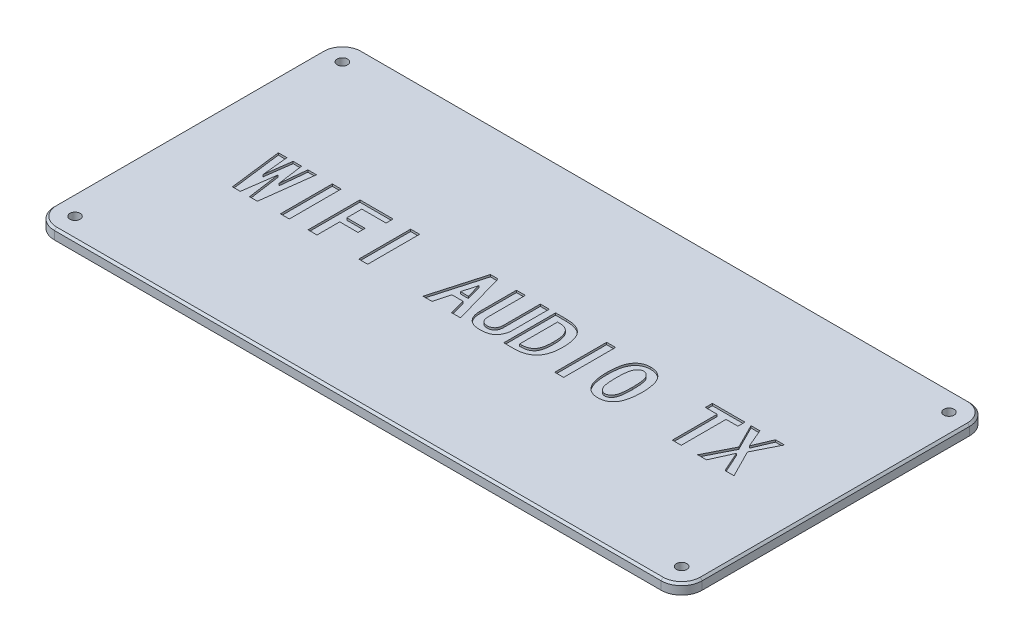
from build123d import *

# Parameters (mm, degrees)
EXTRUDE_1_DEPTH           = 2
SKETCH_2_R                = 1
CUT_EXTRUDE_1_DEPTH       = 2
CUT_EXTRUDE_START         = -0.4
CUT_EXTRUDE_2_OUTLINE_W   = 1.734892788
CUT_EXTRUDE_2_OUTLINE_H   = 10.090968161
CUT_EXTRUDE_2_OUTLINE_W_2 = 1.734892787
CUT_EXTRUDE_2_DEPTH       = 0.4
CHAMFER_1_SIZE            = 0.4


# Read off the part's stored shape, not the designer's step: 切除-拉伸2
with BuildPart() as part:
    # 草图1 → 凸台-拉伸1 (new body)
    with BuildSketch(Plane(origin=(0, 0, 0), x_dir=(1, 0, 0), z_dir=(0, 1, 0))):
        with BuildLine():
            Line((4, 0), (122, 0))
            ThreePointArc((122, 0), (124.828427125, 1.171572875), (126, 4))
            Line((126, 4), (126, 56))
            ThreePointArc((126, 56), (124.828427125, 58.828427125), (122, 60))
            Line((122, 60), (4, 60))
            ThreePointArc((4, 60), (1.171572875, 58.828427125), (0, 56))
            Line((0, 56), (0, 4))
            ThreePointArc((0, 4), (1.171572875, 1.171572875), (4, 0))
        make_face()
    extrude(amount=EXTRUDE_1_DEPTH)

    # 草图2 → 切除-拉伸1 (cut)
    with BuildSketch(Plane(origin=(0, 0, 0), x_dir=(-1, 0, 0), z_dir=(0, -1, 0))):
        with Locations(Location((-122, 4, 0), (0, 0, 90))):
            Circle(SKETCH_2_R)
        with Locations(Location((-122, 56, 0), (0, 0, 90))):
            Circle(SKETCH_2_R)
        with Locations(Location((-4, 56, 0), (0, 0, 90))):
            Circle(SKETCH_2_R)
        with Locations(Location((-4, 4, 0), (0, 0, 90))):
            Circle(SKETCH_2_R)
    extrude(amount=-CUT_EXTRUDE_1_DEPTH, mode=Mode.SUBTRACT)

    # 切除-拉伸2 outline → 切除-拉伸2 (cut)
    # profile 1 of 11: a face of its own
    with BuildSketch(Plane(origin=(0, 2, 0), x_dir=(1, 0, 0), z_dir=(0, 1, 0)).offset(CUT_EXTRUDE_START)):
        with BuildLine():
            add(Edge.make_bspline(
                [(85.38227287, 34.590226226), (85.517467863, 34.586454589), (85.781137425, 34.5790988), (86.164303937, 34.522748921), (86.522256181, 34.426690854), (86.857639647, 34.295233804), (87.165552006, 34.119970878), (87.450967055, 33.910293541), (87.710099989, 33.6612892), (87.943456693, 33.372391473), (88.150415551, 33.041561015), (88.330472898, 32.666100825), (88.4807517, 32.243973045), (88.602927804, 31.775538604), (88.699756944, 31.261738674), (88.767469528, 30.701755827), (88.809000569, 30.095878413), (88.813108364, 29.676572622), (88.815237999, 29.459188756)],
                knots=[0, 0, 0, 0, 0.057802362, 0.11273142, 0.165156482, 0.216010641, 0.26633153, 0.316226286, 0.367105743, 0.419568068, 0.474647899, 0.533611951, 0.597288555, 0.665962198, 0.740442371, 0.820709249, 0.907048943, 1, 1, 1, 1], degree=3))
            add(Edge.make_bspline(
                [(82.029446359, 29.459188756), (82.031294766, 29.680200097), (82.034856582, 30.106081231), (82.080005066, 30.720419049), (82.146720543, 31.286295251), (82.243472591, 31.803983741), (82.367971562, 32.273763812), (82.520413623, 32.695927619), (82.70213062, 33.070137039), (82.913761124, 33.395812413), (83.15026998, 33.677870536), (83.407088302, 33.9225851), (83.685228847, 34.130091095), (83.985423326, 34.297172273), (84.30414374, 34.432084256), (84.645929678, 34.523954902), (85.007976398, 34.578536625), (85.255735962, 34.586274369), (85.38227287, 34.590226226)],
                knots=[0, 0, 0, 0, 0.095491604, 0.184008985, 0.266051824, 0.341624472, 0.41140466, 0.475859752, 0.535302059, 0.590773894, 0.643265744, 0.694025655, 0.743759734, 0.792793041, 0.842161712, 0.892950381, 0.945327125, 1, 1, 1, 1], degree=3))
            add(Edge.make_bspline(
                [(85.38227287, 24.269671753), (85.254996575, 24.273422294), (85.006370611, 24.280748731), (84.644213224, 24.33778099), (84.30295697, 24.433175776), (83.983081708, 24.568386627), (83.683260431, 24.740413009), (83.40610926, 24.953334713), (83.150171517, 25.203944027), (82.913719986, 25.492490946), (82.702094017, 25.824623167), (82.520930295, 26.204735701), (82.367926001, 26.631651505), (82.243510969, 27.105781679), (82.146930593, 27.627074698), (82.079978, 28.195793243), (82.034920455, 28.811579746), (82.031314508, 29.23817871), (82.029446359, 29.459188756)],
                knots=[0, 0, 0, 0, 0.054634439, 0.106724824, 0.156974504, 0.206434745, 0.255462678, 0.305005436, 0.356086938, 0.408961121, 0.464861566, 0.524761641, 0.58938903, 0.659324006, 0.735024887, 0.816853165, 0.905116295, 1, 1, 1, 1], degree=3))
            add(Edge.make_bspline(
                [(88.815237999, 29.459188756), (88.81308983, 29.241087844), (88.808945794, 28.820349137), (88.767600027, 28.21153187), (88.698946799, 27.649027795), (88.606059364, 27.130029669), (88.479719873, 26.658621142), (88.332876574, 26.229699555), (88.152281823, 25.849021724), (87.946456848, 25.511672746), (87.71154824, 25.218337512), (87.454037768, 24.962724652), (87.16870453, 24.749235603), (86.861659041, 24.570746372), (86.526065941, 24.437161961), (86.167232915, 24.339750454), (85.782784159, 24.280032903), (85.518221958, 24.27318873), (85.38227287, 24.269671753)],
                knots=[0, 0, 0, 0, 0.092631858, 0.178696219, 0.259031396, 0.333255065, 0.402434248, 0.466156919, 0.525553907, 0.581043777, 0.633630769, 0.684808419, 0.734734037, 0.784601226, 0.835227375, 0.887675586, 0.942280486, 1, 1, 1, 1], degree=3))
        make_face()
        with BuildLine():
            add(Edge.make_bspline(
                [(85.38227287, 25.636360079), (85.437354472, 25.638161719), (85.546482468, 25.641731138), (85.706545966, 25.679050914), (85.861777049, 25.734589157), (86.00966127, 25.816488197), (86.152173368, 25.919761157), (86.288183936, 26.046087345), (86.418744787, 26.194825552), (86.54517342, 26.369082175), (86.663238179, 26.580677981), (86.757224361, 26.843191362), (86.842118585, 27.153545049), (86.905741699, 27.517104362), (86.960750997, 27.930267353), (86.994449952, 28.395299185), (87.019958175, 28.910206155), (87.021210808, 29.270715676), (87.021865679, 29.459188756)],
                knots=[0, 0, 0, 0, 0.035936664, 0.071197931, 0.10687346, 0.143399994, 0.181246592, 0.221650853, 0.264439433, 0.310403604, 0.362143895, 0.422172202, 0.492108292, 0.572250118, 0.663138505, 0.7644284, 0.876844016, 1, 1, 1, 1], degree=3))
            add(Edge.make_bspline(
                [(83.822818679, 29.459188756), (83.824764769, 29.267850869), (83.828482022, 28.902373913), (83.848540491, 28.379946138), (83.886958556, 27.910196483), (83.940097964, 27.493726299), (84.006889464, 27.129591409), (84.093990092, 26.819318321), (84.189028888, 26.557561849), (84.310149049, 26.349099095), (84.438956549, 26.180686639), (84.566936294, 26.036271206), (84.697122827, 25.914000949), (84.829617697, 25.813078991), (84.964336769, 25.73477709), (85.100433036, 25.676050585), (85.240613626, 25.642839565), (85.33518369, 25.638513936), (85.38227287, 25.636360079)],
                knots=[0, 0, 0, 0, 0.127090223, 0.242756668, 0.347172299, 0.440019481, 0.521558104, 0.592763228, 0.653942454, 0.705926813, 0.752153712, 0.794605084, 0.833961708, 0.870598011, 0.904977416, 0.937216746, 0.968738396, 1, 1, 1, 1], degree=3))
            add(Edge.make_bspline(
                [(85.38227287, 33.2235379), (85.335143374, 33.221492463), (85.240492342, 33.217384574), (85.100796767, 33.182484901), (84.962799163, 33.130524919), (84.827019851, 33.055671175), (84.695747046, 32.957467997), (84.567525338, 32.83839632), (84.438749559, 32.701305487), (84.31015924, 32.539215958), (84.188879682, 32.33732114), (84.093927385, 32.081841949), (84.006210769, 31.776722028), (83.940410532, 31.416661078), (83.886717685, 31.00316979), (83.848588202, 30.536259801), (83.828433976, 30.015285382), (83.824750763, 29.650527711), (83.822818679, 29.459188756)],
                knots=[0, 0, 0, 0, 0.031584383, 0.063431495, 0.096093653, 0.130351727, 0.167076637, 0.205826137, 0.247643444, 0.293195089, 0.344461011, 0.404918503, 0.475460193, 0.557364934, 0.650210001, 0.755220915, 0.871597561, 1, 1, 1, 1], degree=3))
            add(Edge.make_bspline(
                [(87.021865679, 29.459188756), (87.021226126, 29.647662916), (87.020005242, 30.007453204), (86.994418145, 30.520908074), (86.96093798, 30.983092387), (86.905672751, 31.392599554), (86.842595574, 31.751300087), (86.756792024, 32.056324503), (86.663902042, 32.31366573), (86.545122673, 32.51917731), (86.418974611, 32.687253003), (86.287349551, 32.828279918), (86.154114139, 32.952838141), (86.009125312, 33.049092516), (85.862323926, 33.129326659), (85.707333239, 33.183929818), (85.546886488, 33.217340129), (85.437302868, 33.221465998), (85.38227287, 33.2235379)],
                knots=[0, 0, 0, 0, 0.124410113, 0.237494361, 0.339340586, 0.430209388, 0.510230248, 0.579500015, 0.639248908, 0.690268961, 0.735549344, 0.777712068, 0.817533255, 0.855607462, 0.892280538, 0.927709028, 0.963697384, 1, 1, 1, 1], degree=3))
        make_face(mode=Mode.SUBTRACT)
    # profile 2 of 11: a face of its own
    with BuildSketch(Plane(origin=(0, 2, 0), x_dir=(1, 0, 0), z_dir=(0, 1, 0)).offset(CUT_EXTRUDE_START)):
        with BuildLine():
            add(Edge.make_bspline(
                [(69.101137934, 34.47543307), (69.28538215, 34.471714858), (69.64250306, 34.464507839), (70.159300553, 34.408491934), (70.637838692, 34.313918718), (71.078024173, 34.182466677), (71.480556202, 34.013301402), (71.845232588, 33.805027207), (72.170552447, 33.556281269), (72.458054464, 33.268501201), (72.710106403, 32.939870266), (72.923903868, 32.564778313), (73.108206136, 32.147743212), (73.257480056, 31.684573801), (73.37006072, 31.176709229), (73.451345776, 30.624427312), (73.501392457, 30.027575823), (73.507675616, 29.61451403), (73.510927841, 29.400709223)],
                knots=[0, 0, 0, 0, 0.071201178, 0.138009377, 0.200615386, 0.259496855, 0.315264295, 0.369016079, 0.421367624, 0.473064341, 0.525807093, 0.580944039, 0.639536507, 0.701748872, 0.768699696, 0.840366328, 0.917372057, 1, 1, 1, 1], degree=3))
            Line((69.101137934, 34.47543307), (67.011036136, 34.47543307))
            Line((67.011036136, 34.47543307), (67.011036136, 24.384464909))
            Line((67.011036136, 24.384464909), (69.101137934, 24.384464909))
            add(Edge.make_bspline(
                [(73.510927841, 29.400709223), (73.506993868, 29.186905649), (73.499391646, 28.773740013), (73.446778132, 28.176927412), (73.353241407, 27.626870087), (73.227956014, 27.121192457), (73.061045698, 26.66153743), (72.857668348, 26.247715449), (72.618493805, 25.878396639), (72.338907525, 25.557912486), (72.025146186, 25.282887498), (71.689305197, 25.039879436), (71.323310438, 24.838273458), (70.932260079, 24.669641667), (70.511575174, 24.543982698), (70.065606702, 24.449568899), (69.591920507, 24.396297366), (69.267318521, 24.388471417), (69.101137934, 24.384464909)],
                knots=[0, 0, 0, 0, 0.083884036, 0.162102066, 0.234794836, 0.302603191, 0.366226687, 0.426272698, 0.483153898, 0.538366567, 0.592541318, 0.646543992, 0.700689114, 0.756145388, 0.813312224, 0.87264444, 0.934800086, 1, 1, 1, 1], degree=3))
        make_face()
        with BuildLine():
            add(Edge.make_bspline(
                [(69.101137934, 25.751153235), (69.207389183, 25.753610071), (69.413340145, 25.758372255), (69.711915658, 25.7961665), (69.990447664, 25.855063949), (70.24740092, 25.942384537), (70.484381099, 26.053021749), (70.699851905, 26.190803099), (70.89613329, 26.351569894), (71.072932322, 26.539027751), (71.229593734, 26.759356861), (71.360586703, 27.019878146), (71.469653947, 27.320027437), (71.562942095, 27.658743818), (71.632826518, 28.038524988), (71.681024083, 28.45751737), (71.711587421, 28.915817846), (71.715511085, 29.234604528), (71.717555521, 29.400709223)],
                knots=[0, 0, 0, 0, 0.06157925, 0.119361476, 0.17420375, 0.226354123, 0.276345084, 0.325461037, 0.374229775, 0.423086444, 0.474419126, 0.530390201, 0.591577019, 0.659307146, 0.733845725, 0.815199008, 0.903708925, 1, 1, 1, 1], degree=3))
            Line((69.101137934, 25.751153235), (68.745928924, 25.751153235))
            Line((68.745928924, 25.751153235), (68.745928924, 33.108744744))
            Line((68.745928924, 33.108744744), (69.101137934, 33.108744744))
            add(Edge.make_bspline(
                [(71.717555521, 29.400709223), (71.715513057, 29.567536447), (71.71159248, 29.887766725), (71.680987896, 30.348219006), (71.632908873, 30.769405991), (71.562490745, 31.151910442), (71.469817792, 31.495363376), (71.358487203, 31.799999779), (71.226895703, 32.066015711), (71.070999163, 32.292580257), (70.894147806, 32.485567727), (70.700588879, 32.654603834), (70.483965985, 32.796232807), (70.246401232, 32.910967705), (69.989012623, 33.000114903), (69.7113699, 33.06178524), (69.413482252, 33.102071221), (69.207406398, 33.106474221), (69.101137934, 33.108744744)],
                knots=[0, 0, 0, 0, 0.095937682, 0.184155499, 0.265271805, 0.339623548, 0.407614047, 0.469624787, 0.525889424, 0.577833102, 0.627214304, 0.676079586, 0.725254369, 0.775579675, 0.82744862, 0.881538554, 0.938912222, 1, 1, 1, 1], degree=3))
        make_face(mode=Mode.SUBTRACT)
    # profile 3 of 11: a face of its own
    with BuildSketch(Plane(origin=(0, 2, 0), x_dir=(1, 0, 0), z_dir=(0, 1, 0)).offset(CUT_EXTRUDE_START)):
        with BuildLine():
            add(Edge.make_bspline(
                [(65.772136418, 27.392911952), (65.769329735, 27.280210261), (65.763828891, 27.059325145), (65.729837094, 26.735218189), (65.668821013, 26.427431089), (65.58550807, 26.135151239), (65.473019086, 25.861483747), (65.341521788, 25.601198329), (65.182432479, 25.358525099), (65.000533475, 25.132096561), (64.792453755, 24.925631053), (64.550940381, 24.750431659), (64.282611457, 24.599111378), (63.983415026, 24.479377739), (63.656528472, 24.383123385), (63.300010131, 24.318379746), (62.914896493, 24.27572065), (62.648299331, 24.27173512), (62.510278068, 24.269671753)],
                knots=[0, 0, 0, 0, 0.065604887, 0.12857964, 0.189401807, 0.248049595, 0.30517198, 0.361367106, 0.417548089, 0.4737275, 0.530189112, 0.587595214, 0.646861539, 0.709057507, 0.774748476, 0.844887186, 0.91969582, 1, 1, 1, 1], degree=3))
            Line((65.772136418, 27.392911952), (65.772136418, 34.47543307))
            Line((65.772136418, 34.47543307), (64.035077722, 34.47543307))
            Line((64.035077722, 34.47543307), (64.035077722, 27.392911952))
            add(Edge.make_bspline(
                [(62.510278068, 25.636360079), (62.619781204, 25.640906514), (62.830287172, 25.649646463), (63.130232143, 25.729173584), (63.394141918, 25.863847023), (63.586682232, 26.016478552), (63.715529627, 26.166805781), (63.803955406, 26.294793575), (63.873626555, 26.442092006), (63.935191738, 26.601577731), (63.980150053, 26.777599835), (64.012163777, 26.968854315), (64.031572838, 27.175922538), (64.033887566, 27.319228705), (64.035077722, 27.392911952)],
                knots=[0, 0, 0, 0, 0.123775813, 0.23794339, 0.347940895, 0.45718005, 0.513372299, 0.571618332, 0.632646595, 0.697298142, 0.764883334, 0.837828021, 0.916616583, 1, 1, 1, 1], degree=3))
            add(Edge.make_bspline(
                [(61.121930657, 27.392911952), (61.123383501, 27.315645543), (61.126184418, 27.166684793), (61.141689896, 26.952114997), (61.175494271, 26.75554512), (61.217677729, 26.576445973), (61.271344447, 26.413004538), (61.340568241, 26.268715565), (61.420866546, 26.140395212), (61.545015945, 25.99762633), (61.723609793, 25.853154645), (61.964585345, 25.727754611), (62.22948568, 25.64777478), (62.415121696, 25.640228352), (62.510278068, 25.636360079)],
                knots=[0, 0, 0, 0, 0.09101781, 0.175471868, 0.253054426, 0.325649299, 0.392065264, 0.455199651, 0.513697545, 0.569772209, 0.677340989, 0.781931297, 0.888218747, 1, 1, 1, 1], degree=3))
            Line((61.121930657, 27.392911952), (61.121930657, 34.47543307))
            Line((61.121930657, 34.47543307), (59.387037869, 34.47543307))
            Line((59.387037869, 34.47543307), (59.387037869, 27.392911952))
            add(Edge.make_bspline(
                [(62.510278068, 24.269671753), (62.380229257, 24.272062616), (62.128174616, 24.276696478), (61.763522977, 24.315207099), (61.4256422, 24.382044904), (61.114762173, 24.475581599), (60.828404699, 24.590965175), (60.570070557, 24.73759887), (60.339615232, 24.911320316), (60.13625585, 25.111048202), (59.959040536, 25.331950296), (59.80657945, 25.573119752), (59.675724047, 25.831700711), (59.57064642, 26.109366003), (59.487266299, 26.404230661), (59.43056202, 26.717605162), (59.39165305, 27.04899952), (59.388599321, 27.276556208), (59.387037869, 27.392911952)],
                knots=[0, 0, 0, 0, 0.077292091, 0.149803986, 0.217641477, 0.281726179, 0.342535593, 0.40077054, 0.457763532, 0.513604108, 0.569770269, 0.625726167, 0.682920779, 0.741741049, 0.801929414, 0.864805697, 0.930871582, 1, 1, 1, 1], degree=3))
        make_face()
    # profile 4 of 11: a face of its own
    with BuildSketch(Plane(origin=(0, 2, 0), x_dir=(1, 0, 0), z_dir=(0, 1, 0)).offset(CUT_EXTRUDE_START)):
        Polygon((111.802025957, 24.384464909), (109.105469751, 29.686609158), (111.516126022, 34.47543307), (109.7725696, 34.47543307), (108.256433581, 30.916845242), (106.74246347, 34.47543307), (105.016234317, 34.47543307), (107.426890587, 29.688775067), (104.728168473, 24.384464909), (106.454397627, 24.384464909), (108.256433581, 28.402225359), (110.058469535, 24.384464909), align=None)
    # profile 5 of 11: a face of its own
    with BuildSketch(Plane(origin=(0, 2, 0), x_dir=(1, 0, 0), z_dir=(0, 1, 0)).offset(CUT_EXTRUDE_START)):
        Polygon((99.80289232, 24.384464909), (101.537785108, 24.384464909), (101.537785108, 33.108744744), (103.833648222, 33.108744744), (103.833648222, 34.47543307), (97.507029206, 34.47543307), (97.507029206, 33.108744744), (99.80289232, 33.108744744), align=None)
    # profile 6 of 11: a face of its own
    with BuildSketch(Plane(origin=(0, 2, 0), x_dir=(1, 0, 0), z_dir=(0, 1, 0)).offset(CUT_EXTRUDE_START)):
        with Locations((77.798343912, 29.42994899)):
            Rectangle(CUT_EXTRUDE_2_OUTLINE_W, CUT_EXTRUDE_2_OUTLINE_H)
    # profile 7 of 11: a face of its own
    with BuildSketch(Plane(origin=(0, 2, 0), x_dir=(1, 0, 0), z_dir=(0, 1, 0)).offset(CUT_EXTRUDE_START)):
        Polygon((56.844261174, 24.384464909), (58.607310774, 24.384464909), (55.694163708, 34.590226226), (54.20835041, 34.590226226), (51.303866979, 24.384464909), (53.058252944, 24.384464909), (53.861805034, 27.425400581), (56.040709084, 27.425400581), align=None)
        Polygon((55.72232052, 28.794254816), (54.186691324, 28.794254816), (54.950742125, 31.594519821), align=None, mode=Mode.SUBTRACT)
    # profile 8 of 11: a face of its own
    with BuildSketch(Plane(origin=(0, 2, 0), x_dir=(1, 0, 0), z_dir=(0, 1, 0)).offset(CUT_EXTRUDE_START)):
        with Locations((39.678352575, 29.42994899)):
            Rectangle(CUT_EXTRUDE_2_OUTLINE_W_2, CUT_EXTRUDE_2_OUTLINE_H)
    # profile 9 of 11: a face of its own
    with BuildSketch(Plane(origin=(0, 2, 0), x_dir=(1, 0, 0), z_dir=(0, 1, 0)).offset(CUT_EXTRUDE_START)):
        Polygon((28.947358424, 24.384464909), (30.68441712, 24.384464909), (30.68441712, 28.80291845), (34.243004947, 28.80291845), (34.243004947, 30.171772684), (30.68441712, 30.171772684), (30.68441712, 33.108744744), (35.390936505, 33.108744744), (35.390936505, 34.47543307), (28.947358424, 34.47543307), align=None)
    # profile 10 of 11: a face of its own
    with BuildSketch(Plane(origin=(0, 2, 0), x_dir=(1, 0, 0), z_dir=(0, 1, 0)).offset(CUT_EXTRUDE_START)):
        with Locations((24.430356041, 29.42994899)):
            Rectangle(CUT_EXTRUDE_2_OUTLINE_W, CUT_EXTRUDE_2_OUTLINE_H)
    # profile 11 of 11: a face of its own
    with BuildSketch(Plane(origin=(0, 2, 0), x_dir=(1, 0, 0), z_dir=(0, 1, 0)).offset(CUT_EXTRUDE_START)):
        Polygon((20.487319437, 34.47543307), (18.821735725, 34.47543307), (18.302194294, 29.336954808), (17.595831458, 34.47543307), (15.956238649, 34.47543307), (15.248096561, 29.336954808), (14.730334382, 34.47543307), (13.069082487, 34.47543307), (14.34696856, 24.269671753), (15.873934122, 24.269671753), (16.776035053, 30.684611709), (17.678135985, 24.269671753), (19.205101547, 24.269671753), align=None)
    extrude(amount=CUT_EXTRUDE_2_DEPTH, mode=Mode.SUBTRACT)

    # 倒角1
    chamfer_1_edges = [part.edges().sort_by_distance(p)[0] for p in [
        (1.171572875, 2, -58.828427125),
        (0, 2, -30),
        (1.171572875, 2, -1.171572875),
        (63, 2, 0),
        (124.828427125, 2, -1.171572875),
        (126, 2, -30),
        (124.828427125, 2, -58.828427125),
        (63, 2, -60),
    ]]
    chamfer(chamfer_1_edges, length=CHAMFER_1_SIZE)


solid = part.part
